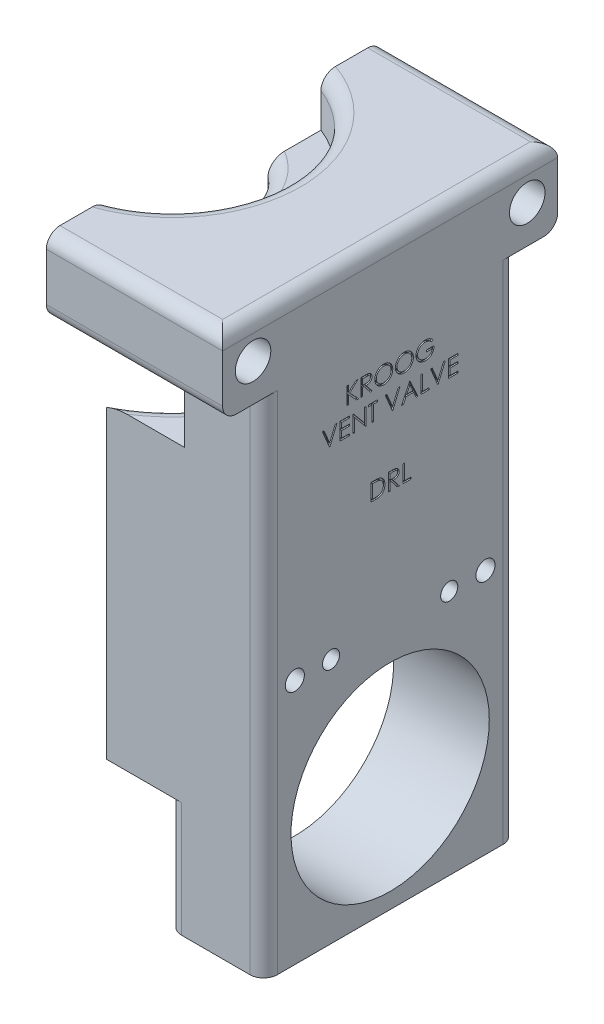
from build123d import *

# Parameters (mm, degrees)
SKETCH2_R                = 18.415
BOSS_EXTRUDE1_DEPTH      = 17.78
BOSS_EXTRUDE2_DEPTH      = 11.43
CUT_EXTRUDE1_START       = -13.97
SKETCH5_R                = 34.925
CUT_EXTRUDE1_DEPTH       = 15.24
CUT_EXTRUDE2_START       = -29.21
SKETCH5_3_R              = 25.4
CUT_EXTRUDE2_DEPTH       = 41.91
SKETCH6_W                = 62.23
SKETCH6_H                = 13.97
BOSS_EXTRUDE3_DEPTH      = 3.530092
BOSS_EXTRUDE5_DEPTH      = 11.43
SKETCH13_R               = 1.778
SKETCH13_R_2             = 1.5875
CUT_EXTRUDE5_DEPTH       = 98.68337548
CUT_EXTRUDE6_START       = -13.97
CUT_EXTRUDE6_OUTLINE_R   = 1.5875
CUT_EXTRUDE6_OUTLINE_R_2 = 1.778
CUT_EXTRUDE6_DEPTH       = 10.623863236
SKETCH15_R               = 3.302
CUT_EXTRUDE7_DEPTH       = 98.683375514
SKETCH17_R               = 21.336
CUT_EXTRUDE9_DEPTH       = 8.89
SKETCH18_R               = 12.7
SKETCH18_R_2             = 2.050850912
CUT_EXTRUDE10_DEPTH      = 8.89
CUT_EXTRUDE8_DEPTH       = 0.254
FILLET1_R                = 2.54
FILLET6_R                = 1.27
FILLET7_R                = 2.54
SKETCH19_R               = 4.064
CUT_EXTRUDE11_DEPTH      = 1.27


# Read off the part's stored shape, not the designer's step: Cut-Extrude6
with BuildPart() as part:
    # Sketch2 → Boss-Extrude1 (new body)
    with BuildSketch(Plane(origin=(0, 0, 0), x_dir=(0, 0, -1), z_dir=(1, 0, 0))):
        Polygon((-23.495, -21.336), (23.495, -21.336), (23.495, 72.644), (31.115, 72.644), (31.115, 86.614), (23.495, 86.614), (-23.495, 86.614), (-31.115, 86.614), (-31.115, 72.644), (-23.495, 72.644), align=None)
        Circle(SKETCH2_R, mode=Mode.SUBTRACT)
    extrude(amount=BOSS_EXTRUDE1_DEPTH)

    # Sketch4 → Boss-Extrude2 (add)
    with BuildSketch(Plane.ZY):
        Polygon((-23.495, 18.796), (23.495, 18.796), (23.495, 72.644), (31.115, 72.644), (31.115, 86.614), (-31.115, 86.614), (-31.115, 72.644), (-23.495, 72.644), align=None)
    extrude(amount=BOSS_EXTRUDE2_DEPTH)

    # Sketch5 → Cut-Extrude1 (cut)
    with BuildSketch(Plane(origin=(0, 86.614, 0), x_dir=(1, 0, 0), z_dir=(0, 1, 0)).offset(CUT_EXTRUDE1_START)):
        with Locations((-22.73046, 0)):
            Circle(SKETCH5_R)
    extrude(amount=-CUT_EXTRUDE1_DEPTH, mode=Mode.SUBTRACT)

    # Sketch5<3> → Cut-Extrude2 (cut)
    with BuildSketch(Plane(origin=(0, 86.614, 0), x_dir=(1, 0, 0), z_dir=(0, 1, 0)).offset(CUT_EXTRUDE2_START)):
        with Locations((-22.73046, 0)):
            Circle(SKETCH5_3_R)
    extrude(amount=-CUT_EXTRUDE2_DEPTH, mode=Mode.SUBTRACT)

    # Sketch6 → Boss-Extrude3 (add)
    with BuildSketch(Plane.ZY.offset(11.43)):
        with Locations((0, 79.629)):
            Rectangle(SKETCH6_W, SKETCH6_H)
    extrude(amount=BOSS_EXTRUDE3_DEPTH)

    # Sketch12 → Boss-Extrude5 (add)
    with BuildSketch(Plane.ZY):
        with BuildLine():
            Line((-23.495, 18.796), (-11.335174819, 18.796))
            Line((-11.335174819, 18.796), (-11.335174819, 15.310660071))
            ThreePointArc((-11.335174819, 15.310660071), (-17.012312898, 8.572263986), (-19.05, 0))
            Line((-19.05, 0), (-23.495, 0))
            Line((-23.495, 0), (-23.495, 18.796))
        make_face()
        with BuildLine():
            Line((19.05, 0), (23.495, 0))
            Line((23.495, 0), (23.495, 18.796))
            Line((23.495, 18.796), (11.335174819, 18.796))
            Line((11.335174819, 18.796), (11.335174819, 15.310660071))
            ThreePointArc((11.335174819, 15.310660071), (17.012312898, 8.572263986), (19.05, 0))
        make_face()
    extrude(amount=BOSS_EXTRUDE5_DEPTH)

    # Sketch13 → Cut-Extrude5 (cut, through all)
    with BuildSketch(Plane(origin=(17.78, 0, 0), x_dir=(0, 0, -1), z_dir=(1, 0, 0))):
        with Locations((-17.7038, 24.384)):
            Circle(SKETCH13_R)
        with Locations((-10.9728, 24.384)):
            Circle(SKETCH13_R_2)
        with Locations((17.7038, 24.384)):
            Circle(SKETCH13_R)
        with Locations((10.9728, 24.384)):
            Circle(SKETCH13_R_2)
    extrude(amount=-CUT_EXTRUDE5_DEPTH, mode=Mode.SUBTRACT)

    # Cut-Extrude6 outline → Cut-Extrude6 (cut)
    # profile 1 of 2: a face of its own
    with BuildSketch(Plane.ZY.offset(11.43).offset(CUT_EXTRUDE6_START)):
        with BuildLine():
            Line((7.9248, 21.336), (17.703787428, 21.336))
            ThreePointArc((17.703787428, 21.336), (19.859057024, 22.228734086), (20.7518, 24.384))
            Line((20.7518, 24.384), (20.7518, 49.784))
            Line((20.7518, 49.784), (7.9248, 49.784))
            Line((7.9248, 49.784), (7.9248, 21.336))
        make_face()
        with Locations((10.9728, 24.384)):
            Circle(CUT_EXTRUDE6_OUTLINE_R, mode=Mode.SUBTRACT)
        with Locations((17.7038, 24.384)):
            Circle(CUT_EXTRUDE6_OUTLINE_R_2, mode=Mode.SUBTRACT)
    # profile 2 of 2: a face of its own
    with BuildSketch(Plane.ZY.offset(11.43).offset(CUT_EXTRUDE6_START)):
        with BuildLine():
            Line((-17.703799921, 21.336), (-7.9248, 21.336))
            Line((-7.9248, 21.336), (-7.9248, 49.784))
            Line((-7.9248, 49.784), (-20.7518, 49.784))
            Line((-20.7518, 49.784), (-20.7518, 24.384))
            ThreePointArc((-20.7518, 24.384), (-19.859061441, 22.228738503), (-17.703799921, 21.336))
        make_face()
        with Locations((-17.7038, 24.384)):
            Circle(CUT_EXTRUDE6_OUTLINE_R_2, mode=Mode.SUBTRACT)
        with Locations((-10.9728, 24.384)):
            Circle(CUT_EXTRUDE6_OUTLINE_R, mode=Mode.SUBTRACT)
    extrude(amount=CUT_EXTRUDE6_DEPTH, mode=Mode.SUBTRACT)

    # Sketch15 → Cut-Extrude7 (cut, through all)
    with BuildSketch(Plane.ZY.offset(14.960092)):
        with Locations((-25.4635, 79.629)):
            Circle(SKETCH15_R)
        with Locations(Location((25.4635, 79.629, 0), (0, 0, 180))):
            Circle(SKETCH15_R)
    extrude(amount=-CUT_EXTRUDE7_DEPTH, mode=Mode.SUBTRACT)

    # Sketch17 → Cut-Extrude9 (cut)
    with BuildSketch(Plane(origin=(0, 86.614, 0), x_dir=(1, 0, 0), z_dir=(0, 1, 0))):
        with Locations((-22.707092, 0)):
            Circle(SKETCH17_R)
    extrude(amount=-CUT_EXTRUDE9_DEPTH, mode=Mode.SUBTRACT)

    # Sketch18 → Cut-Extrude10 (cut)
    with BuildSketch(Plane(origin=(0, 77.724, 0), x_dir=(1, 0, 0), z_dir=(0, 1, 0))):
        with Locations((-22.707092, 0)):
            Circle(SKETCH18_R)
        with Locations(Location((-5.22986, 0, 0), (0, 0, 270))):
            Circle(SKETCH18_R_2)
    extrude(amount=-CUT_EXTRUDE10_DEPTH, mode=Mode.SUBTRACT)

    # Sketch16 → Cut-Extrude8 (cut)
    # profile 1 of 17: a face of its own
    with BuildSketch(Plane(origin=(17.78, 0, 0), x_dir=(0, 0, -1), z_dir=(1, 0, 0))):
        Polygon((-7.978205128, 66.929), (-7.693269231, 66.929), (-7.693269231, 65.719930489), (-6.369716546, 66.929), (-5.963301282, 66.929), (-7.523452524, 65.504320513), (-5.841185897, 63.754), (-6.221524439, 63.754), (-7.693269231, 65.286166466), (-7.693269231, 63.754), (-7.978205128, 63.754), align=None)
    # profile 2 of 17: a face of its own
    with BuildSketch(Plane(origin=(17.78, 0, 0), x_dir=(0, 0, -1), z_dir=(1, 0, 0))):
        with BuildLine():
            Line((-5.373076923, 66.929), (-4.737695313, 66.929))
            add(Edge.make_bspline(
                [(-4.737695313, 66.929), (-4.695294432, 66.928858861), (-4.613880043, 66.928587859), (-4.49724572, 66.927076774), (-4.391266853, 66.922745752), (-4.295998856, 66.91901868), (-4.211443476, 66.912222418), (-4.137341434, 66.905726689), (-4.074034023, 66.897223439), (-4.035711, 66.889326377), (-4.018359375, 66.885750801)],
                knots=[0, 0, 0, 0, 1.410062039, 2.707475311, 3.878576406, 4.937260626, 5.877586885, 6.699081471, 7.410979367, 8, 8, 8, 8], degree=3))
            add(Edge.make_bspline(
                [(-4.018359375, 66.885750801), (-3.995130509, 66.880011521), (-3.949168311, 66.868655396), (-3.88299218, 66.844652758), (-3.819932757, 66.816876384), (-3.760251988, 66.784252152), (-3.704248806, 66.746537888), (-3.651345767, 66.704384662), (-3.601302811, 66.658023126), (-3.556143761, 66.606284377), (-3.513563335, 66.552004114), (-3.477650796, 66.493308563), (-3.446693203, 66.431929892), (-3.422045663, 66.367243877), (-3.402199216, 66.299877841), (-3.388205413, 66.229221576), (-3.379813264, 66.155596977), (-3.378958866, 66.105379445), (-3.378525641, 66.079916466)],
                knots=[0, 0, 0, 0, 1.027469482, 2.033020251, 3.019912614, 3.986113645, 4.951240523, 5.91722682, 6.890402269, 7.87763091, 8.8651537, 9.85103654, 10.82876324, 11.815024772, 12.821070561, 13.842952187, 14.906261191, 16, 16, 16, 16], degree=3))
            add(Edge.make_bspline(
                [(-3.378525641, 66.079916466), (-3.379858232, 66.037611764), (-3.382458463, 65.955064333), (-3.40670195, 65.835266248), (-3.446413507, 65.723515941), (-3.501135347, 65.61995412), (-3.570821586, 65.526599463), (-3.654573361, 65.444602407), (-3.752437394, 65.375986201), (-3.843541131, 65.328404013), (-3.924017583, 65.297930446), (-3.990269231, 65.276488892), (-4.062538561, 65.259922681), (-4.140133143, 65.245081704), (-4.223375888, 65.233876953), (-4.312067281, 65.225670399), (-4.406270575, 65.220541369), (-4.470985303, 65.219777551), (-4.504276843, 65.219384615)],
                knots=[0, 0, 0, 0, 1.260483769, 2.459530307, 3.627416485, 4.787058657, 5.939039949, 7.08810263, 8.267026773, 9.491475466, 10.141966685, 10.831826277, 11.566392101, 12.351337768, 13.187381173, 14.07005841, 15.007169909, 16, 16, 16, 16], degree=3))
            Line((-4.504276843, 65.219384615), (-3.337820513, 63.754))
            Line((-3.337820513, 63.754), (-3.690174279, 63.754))
            Line((-3.690174279, 63.754), (-4.856630609, 65.219384615))
            Line((-4.856630609, 65.219384615), (-5.088141026, 65.219384615))
            Line((-5.088141026, 65.219384615), (-5.088141026, 63.754))
            Line((-5.088141026, 63.754), (-5.373076923, 63.754))
            Line((-5.373076923, 63.754), (-5.373076923, 66.929))
        make_face()
        with BuildLine():
            Line((-5.088141026, 66.603358974), (-5.088141026, 65.545025641))
            Line((-5.088141026, 65.545025641), (-4.506820913, 65.540573518))
            add(Edge.make_bspline(
                [(-4.506820913, 65.540573518), (-4.479679164, 65.54056151), (-4.427070723, 65.540538236), (-4.350960834, 65.544161162), (-4.280094733, 65.5482826), (-4.214743479, 65.55458665), (-4.154877878, 65.562711086), (-4.100527854, 65.572873793), (-4.051604685, 65.584713879), (-3.994546725, 65.603039639), (-3.930832157, 65.63207367), (-3.861588619, 65.674315229), (-3.802622212, 65.727445788), (-3.752803866, 65.78820028), (-3.712772167, 65.854998877), (-3.68454909, 65.927040869), (-3.666639874, 66.002507533), (-3.664527551, 66.054376245), (-3.663461538, 66.080552484)],
                knots=[0, 0, 0, 0, 1.146690395, 2.22261258, 3.21895312, 4.145990853, 4.996080663, 5.770904154, 6.481378293, 7.121626537, 8.300444488, 9.431385265, 10.535395872, 11.636531494, 12.74115979, 13.810798291, 14.895190096, 16, 16, 16, 16], degree=3))
            add(Edge.make_bspline(
                [(-3.663461538, 66.080552484), (-3.664552034, 66.106085447), (-3.666712998, 66.156682464), (-3.68435581, 66.23075604), (-3.714191177, 66.300666773), (-3.754397779, 66.36613027), (-3.803382726, 66.42555333), (-3.860821028, 66.476396105), (-3.925142169, 66.518350976), (-3.985259613, 66.545161022), (-4.038993506, 66.561598317), (-4.085647555, 66.573165444), (-4.138362967, 66.582458641), (-4.197395704, 66.589904525), (-4.262493755, 66.596304367), (-4.333986274, 66.600614909), (-4.411398925, 66.603167486), (-4.465053641, 66.603293659), (-4.492828526, 66.603358974)],
                knots=[0, 0, 0, 0, 1.101028733, 2.181837193, 3.264309656, 4.369019818, 5.486613113, 6.575447106, 7.666700264, 8.788928104, 9.402425223, 10.0903467, 10.862060571, 11.710948788, 12.657782767, 13.684531032, 14.801375019, 16, 16, 16, 16], degree=3))
            Line((-4.492828526, 66.603358974), (-5.088141026, 66.603358974))
        make_face(mode=Mode.SUBTRACT)
    # profile 3 of 17: a face of its own
    with BuildSketch(Plane(origin=(17.78, 0, 0), x_dir=(0, 0, -1), z_dir=(1, 0, 0))):
        with BuildLine():
            add(Edge.make_bspline(
                [(-1.200801282, 67.010410256), (-1.142011072, 67.0089212), (-1.026542248, 67.005996571), (-0.856838591, 66.983609098), (-0.694827326, 66.94487828), (-0.5391887, 66.893295432), (-0.391784357, 66.824484668), (-0.25150479, 66.74131314), (-0.118683769, 66.642909496), (0.004888484, 66.530034411), (0.117970146, 66.407222278), (0.217597915, 66.276160174), (0.301093424, 66.137640546), (0.369660531, 65.99207965), (0.423452841, 65.839806679), (0.460572259, 65.680009834), (0.484283296, 65.513724479), (0.487055322, 65.400307252), (0.488461538, 65.342772035)],
                knots=[0, 0, 0, 0, 1.065120563, 2.091984664, 3.0946048, 4.079830382, 5.057816894, 6.036188127, 7.030412546, 8.04752943, 9.064399622, 10.05169764, 11.02544977, 11.989514704, 12.962713494, 13.945757189, 14.957906945, 16, 16, 16, 16], degree=3))
            add(Edge.make_bspline(
                [(0.488461538, 65.342772035), (0.487055528, 65.285660637), (0.484284119, 65.173087456), (0.4605453, 65.007857332), (0.42331525, 64.849025057), (0.370160065, 64.696855786), (0.30191981, 64.551188996), (0.217868333, 64.412407974), (0.118861663, 64.280467222), (0.006188306, 64.156812161), (-0.116639782, 64.043421599), (-0.248384382, 63.944616618), (-0.386082608, 63.859595448), (-0.531506414, 63.791755973), (-0.682727162, 63.737534302), (-0.841098269, 63.700565845), (-1.005877643, 63.676719741), (-1.11824634, 63.673981516), (-1.175360577, 63.672589744)],
                knots=[0, 0, 0, 0, 1.043624062, 2.057103931, 3.04512605, 4.022047818, 4.998200453, 5.980619268, 6.982898556, 8.009068085, 9.034988726, 10.034168286, 11.015286542, 11.987931943, 12.962482838, 13.94673481, 14.956375938, 16, 16, 16, 16], degree=3))
            add(Edge.make_bspline(
                [(-1.175360577, 63.672589744), (-1.232895495, 63.673995259), (-1.346312134, 63.676765903), (-1.512806444, 63.700516178), (-1.67271554, 63.737655789), (-1.82558213, 63.790732206), (-1.971491459, 63.859327837), (-2.110728892, 63.942970381), (-2.242735547, 64.042218287), (-2.366416988, 64.154855109), (-2.479582332, 64.277475017), (-2.578242623, 64.408860377), (-2.661903976, 64.546433541), (-2.730269285, 64.690576295), (-2.784393473, 64.840591818), (-2.821318558, 64.997480794), (-2.845209028, 65.160348774), (-2.847962068, 65.271240546), (-2.849358974, 65.327507612)],
                knots=[0, 0, 0, 0, 1.053102029, 2.075944431, 3.073151272, 4.055350789, 5.033113405, 6.020478099, 7.024410459, 8.052272461, 9.079885166, 10.07527673, 11.055994387, 12.023226415, 12.992069828, 13.970394897, 14.97016774, 16, 16, 16, 16], degree=3))
            add(Edge.make_bspline(
                [(-2.849358974, 65.327507612), (-2.848873984, 65.365274391), (-2.84791012, 65.440331503), (-2.836306228, 65.551789061), (-2.819468113, 65.661454158), (-2.795336378, 65.769014947), (-2.763775366, 65.874208126), (-2.726535313, 65.977759175), (-2.68105131, 66.078618696), (-2.629633865, 66.177264487), (-2.572246368, 66.272158801), (-2.508859081, 66.361856709), (-2.441698425, 66.447110899), (-2.368071632, 66.525712109), (-2.290405286, 66.599946926), (-2.207439471, 66.668674534), (-2.119680435, 66.732514668), (-2.026750562, 66.790045977), (-1.930939699, 66.842078906), (-1.832172907, 66.886730157), (-1.731791589, 66.92505337), (-1.629325587, 66.95611469), (-1.525047001, 66.980636608), (-1.418728239, 66.997334708), (-1.310454002, 67.008968196), (-1.237509449, 67.009927501), (-1.200801282, 67.010410256)],
                knots=[0, 0, 0, 0, 1.037015668, 2.060948919, 3.074880161, 4.083647147, 5.086022904, 6.090072063, 7.104153813, 8.122640571, 9.144368836, 10.147691507, 11.138137339, 12.123020368, 13.103399296, 14.087645067, 15.080126199, 16.082011238, 17.087798457, 18.072939717, 19.057185487, 20.037253025, 21.01195951, 21.997135196, 22.992090687, 24, 24, 24, 24], degree=3))
        make_face()
        with BuildLine():
            add(Edge.make_bspline(
                [(-1.186808894, 66.684769231), (-1.216939312, 66.684401937), (-1.276912098, 66.683670862), (-1.366070213, 66.674040892), (-1.454055753, 66.660315921), (-1.540886889, 66.640738399), (-1.626200308, 66.614064722), (-1.710791236, 66.583366184), (-1.793888292, 66.545972766), (-1.875217149, 66.50372467), (-1.954061538, 66.456962435), (-2.028458774, 66.405280903), (-2.098601459, 66.349892072), (-2.164317851, 66.290666676), (-2.225414985, 66.227303109), (-2.283095393, 66.160761971), (-2.335047085, 66.089141327), (-2.382659001, 66.014383315), (-2.425265542, 65.936585309), (-2.463152685, 65.856566362), (-2.494144322, 65.773673747), (-2.519419477, 65.688806761), (-2.540374306, 65.602099815), (-2.553649365, 65.512895152), (-2.563385149, 65.421641015), (-2.564074437, 65.359971762), (-2.564423077, 65.328779647)],
                knots=[0, 0, 0, 0, 1.008559885, 2.007477868, 2.99961109, 3.989939068, 4.984837346, 5.991145699, 7.001802488, 8.033829008, 9.059044045, 10.069351652, 11.065060232, 12.050310815, 13.029377138, 14.011219647, 14.996725999, 15.989392538, 16.977580475, 17.965360261, 18.951710183, 19.937753436, 20.929683414, 21.935841486, 22.955955122, 24, 24, 24, 24], degree=3))
            add(Edge.make_bspline(
                [(-2.564423077, 65.328779647), (-2.563266595, 65.28291249), (-2.560991437, 65.192677602), (-2.541072784, 65.060445071), (-2.510391422, 64.933364983), (-2.465163668, 64.81213268), (-2.408602753, 64.69570608), (-2.33872836, 64.585118014), (-2.255943332, 64.480338592), (-2.161905705, 64.382099312), (-2.059105821, 64.292432047), (-1.949946844, 64.213725241), (-1.835598215, 64.147131657), (-1.715761738, 64.092879913), (-1.591077185, 64.04989065), (-1.460741121, 64.020427892), (-1.325621775, 64.001037301), (-1.233518966, 63.999175158), (-1.186808894, 63.998230769)],
                knots=[0, 0, 0, 0, 1.032063989, 2.030389145, 3.003944642, 3.970395727, 4.937377036, 5.913328081, 6.909231446, 7.93887556, 8.970685674, 9.976071282, 10.964166581, 11.944589148, 12.933237628, 13.927779006, 14.949070134, 16, 16, 16, 16], degree=3))
            add(Edge.make_bspline(
                [(-1.186808894, 63.998230769), (-1.155413132, 63.99866212), (-1.093145906, 63.999517617), (-1.000530682, 64.008134274), (-0.909583976, 64.021951755), (-0.820433351, 64.041845993), (-0.733179986, 64.06674453), (-0.6474597, 64.096324398), (-0.564185537, 64.133228061), (-0.48230697, 64.174002274), (-0.403933236, 64.220484417), (-0.329116146, 64.270411882), (-0.259741507, 64.32571913), (-0.194074278, 64.384064575), (-0.132726303, 64.446624637), (-0.076112439, 64.513317981), (-0.024423319, 64.584565577), (0.023170517, 64.659210195), (0.065627763, 64.737221081), (0.102620231, 64.817530146), (0.134003851, 64.899939638), (0.159338994, 64.984568421), (0.179192235, 65.071255762), (0.192871876, 65.160117733), (0.202440817, 65.250976565), (0.203162066, 65.312429921), (0.203525641, 65.343408053)],
                knots=[0, 0, 0, 0, 1.047197238, 2.076906641, 3.100256066, 4.114471768, 5.12198147, 6.126382909, 7.136867548, 8.15857795, 9.17633901, 10.174870724, 11.156907918, 12.133735059, 13.104061851, 14.077631395, 15.04955518, 16.038496417, 17.029181396, 18.010275684, 18.986308667, 19.968651475, 20.955262928, 21.950658345, 22.966943676, 24, 24, 24, 24], degree=3))
            add(Edge.make_bspline(
                [(0.203525641, 65.343408053), (0.203161774, 65.37417426), (0.202439977, 65.4352047), (0.192876447, 65.525429871), (0.179177782, 65.613652427), (0.159435897, 65.69952602), (0.1339904, 65.783072539), (0.102614751, 65.864213517), (0.065616658, 65.943251237), (0.023154911, 66.019990349), (-0.024575157, 66.093627433), (-0.076730649, 66.164023907), (-0.134212072, 66.229857751), (-0.195377109, 66.292754224), (-0.261753555, 66.351371881), (-0.333040736, 66.405730167), (-0.408373215, 66.457140923), (-0.488135779, 66.503519112), (-0.570453508, 66.546349166), (-0.65492117, 66.583044004), (-0.740581854, 66.614224427), (-0.827217727, 66.640819102), (-0.915558, 66.660239244), (-1.005005759, 66.67405326), (-1.095437251, 66.68366751), (-1.156255029, 66.684400825), (-1.186808894, 66.684769231)],
                knots=[0, 0, 0, 0, 1.02996197, 2.043119294, 3.035359645, 4.018872909, 4.991431989, 5.957985074, 6.929999688, 7.912076566, 8.892894881, 9.867085534, 10.843653904, 11.817741046, 12.803660682, 13.806313499, 14.818574707, 15.856120519, 16.894564902, 17.924820532, 18.937903209, 19.946497019, 20.957711757, 21.963978472, 22.977135795, 24, 24, 24, 24], degree=3))
        make_face(mode=Mode.SUBTRACT)
    # profile 4 of 17: a face of its own
    with BuildSketch(Plane(origin=(17.78, 0, 0), x_dir=(0, 0, -1), z_dir=(1, 0, 0))):
        with BuildLine():
            add(Edge.make_bspline(
                [(2.625480769, 67.010410256), (2.68427098, 67.0089212), (2.799739803, 67.005996571), (2.96944346, 66.983609098), (3.131454725, 66.94487828), (3.287093351, 66.893295432), (3.434497694, 66.824484668), (3.574777261, 66.74131314), (3.707598282, 66.642909496), (3.831170536, 66.530034411), (3.944252198, 66.407222278), (4.043879966, 66.276160174), (4.127375475, 66.137640546), (4.195942582, 65.99207965), (4.249734892, 65.839806679), (4.286854311, 65.680009834), (4.310565347, 65.513724479), (4.313337373, 65.400307252), (4.31474359, 65.342772035)],
                knots=[0, 0, 0, 0, 1.065120563, 2.091984664, 3.0946048, 4.079830382, 5.057816894, 6.036188127, 7.030412546, 8.04752943, 9.064399622, 10.05169764, 11.02544977, 11.989514704, 12.962713494, 13.945757189, 14.957906945, 16, 16, 16, 16], degree=3))
            add(Edge.make_bspline(
                [(4.31474359, 65.342772035), (4.31333758, 65.285660637), (4.31056617, 65.173087456), (4.286827351, 65.007857332), (4.249597301, 64.849025057), (4.196442117, 64.696855786), (4.128201861, 64.551188996), (4.044150384, 64.412407974), (3.945143715, 64.280467222), (3.832470357, 64.156812161), (3.709642269, 64.043421599), (3.57789767, 63.944616618), (3.440199444, 63.859595448), (3.294775637, 63.791755973), (3.143554889, 63.737534302), (2.985183782, 63.700565845), (2.820404408, 63.676719741), (2.708035712, 63.673981516), (2.650921474, 63.672589744)],
                knots=[0, 0, 0, 0, 1.043624062, 2.057103931, 3.04512605, 4.022047818, 4.998200453, 5.980619268, 6.982898556, 8.009068085, 9.034988726, 10.034168286, 11.015286542, 11.987931943, 12.962482838, 13.94673481, 14.956375938, 16, 16, 16, 16], degree=3))
            add(Edge.make_bspline(
                [(2.650921474, 63.672589744), (2.593386556, 63.673995259), (2.479969918, 63.676765903), (2.313475607, 63.700516178), (2.153566511, 63.737655789), (2.000699921, 63.790732206), (1.854790592, 63.859327837), (1.71555316, 63.942970381), (1.583546505, 64.042218287), (1.459865063, 64.154855109), (1.346699719, 64.277475017), (1.248039428, 64.408860377), (1.164378076, 64.546433541), (1.096012767, 64.690576295), (1.041888579, 64.840591818), (1.004963494, 64.997480794), (0.981073023, 65.160348774), (0.978319983, 65.271240546), (0.976923077, 65.327507612)],
                knots=[0, 0, 0, 0, 1.053102029, 2.075944431, 3.073151272, 4.055350789, 5.033113405, 6.020478099, 7.024410459, 8.052272461, 9.079885166, 10.07527673, 11.055994387, 12.023226415, 12.992069828, 13.970394897, 14.97016774, 16, 16, 16, 16], degree=3))
            add(Edge.make_bspline(
                [(0.976923077, 65.327507612), (0.977408068, 65.365274391), (0.978371931, 65.440331503), (0.989975823, 65.551789061), (1.006813938, 65.661454158), (1.030945673, 65.769014947), (1.062506685, 65.874208126), (1.099746739, 65.977759175), (1.145230741, 66.078618696), (1.196648186, 66.177264487), (1.254035683, 66.272158801), (1.31742297, 66.361856709), (1.384583626, 66.447110899), (1.458210419, 66.525712109), (1.535876766, 66.599946926), (1.61884258, 66.668674534), (1.706601616, 66.732514668), (1.799531489, 66.790045977), (1.895342353, 66.842078906), (1.994109144, 66.886730157), (2.094490462, 66.92505337), (2.196956465, 66.95611469), (2.301235051, 66.980636608), (2.407553812, 66.997334708), (2.515828049, 67.008968196), (2.588772603, 67.009927501), (2.625480769, 67.010410256)],
                knots=[0, 0, 0, 0, 1.037015668, 2.060948919, 3.074880161, 4.083647147, 5.086022904, 6.090072063, 7.104153813, 8.122640571, 9.144368836, 10.147691507, 11.138137339, 12.123020368, 13.103399296, 14.087645067, 15.080126199, 16.082011238, 17.087798457, 18.072939717, 19.057185487, 20.037253025, 21.01195951, 21.997135196, 22.992090687, 24, 24, 24, 24], degree=3))
        make_face()
        with BuildLine():
            add(Edge.make_bspline(
                [(2.639473157, 66.684769231), (2.609342739, 66.684401937), (2.549369953, 66.683670862), (2.460211838, 66.674040892), (2.372226298, 66.660315921), (2.285395162, 66.640738399), (2.200081743, 66.614064722), (2.115490815, 66.583366184), (2.032393759, 66.545972766), (1.951064903, 66.50372467), (1.872220513, 66.456962435), (1.797823277, 66.405280903), (1.727680593, 66.349892072), (1.661964201, 66.290666676), (1.600867066, 66.227303109), (1.543186658, 66.160761971), (1.491234966, 66.089141327), (1.44362305, 66.014383315), (1.401016509, 65.936585309), (1.363129366, 65.856566362), (1.33213773, 65.773673747), (1.306862574, 65.688806761), (1.285907746, 65.602099815), (1.272632686, 65.512895152), (1.262896903, 65.421641015), (1.262207614, 65.359971762), (1.261858974, 65.328779647)],
                knots=[0, 0, 0, 0, 1.008559885, 2.007477868, 2.99961109, 3.989939068, 4.984837346, 5.991145699, 7.001802488, 8.033829008, 9.059044045, 10.069351652, 11.065060232, 12.050310815, 13.029377138, 14.011219647, 14.996725999, 15.989392538, 16.977580475, 17.965360261, 18.951710183, 19.937753436, 20.929683414, 21.935841486, 22.955955122, 24, 24, 24, 24], degree=3))
            add(Edge.make_bspline(
                [(1.261858974, 65.328779647), (1.263015456, 65.28291249), (1.265290614, 65.192677602), (1.285209267, 65.060445071), (1.315890629, 64.933364983), (1.361118383, 64.81213268), (1.417679298, 64.69570608), (1.487553691, 64.585118014), (1.570338719, 64.480338592), (1.664376347, 64.382099312), (1.76717623, 64.292432047), (1.876335207, 64.213725241), (1.990683837, 64.147131657), (2.110520313, 64.092879913), (2.235204867, 64.04989065), (2.365540931, 64.020427892), (2.500660276, 64.001037301), (2.592763085, 63.999175158), (2.639473157, 63.998230769)],
                knots=[0, 0, 0, 0, 1.032063989, 2.030389145, 3.003944642, 3.970395727, 4.937377036, 5.913328081, 6.909231446, 7.93887556, 8.970685674, 9.976071282, 10.964166581, 11.944589148, 12.933237628, 13.927779006, 14.949070134, 16, 16, 16, 16], degree=3))
            add(Edge.make_bspline(
                [(2.639473157, 63.998230769), (2.670868919, 63.99866212), (2.733136145, 63.999517617), (2.825751369, 64.008134274), (2.916698075, 64.021951755), (3.005848701, 64.041845993), (3.093102065, 64.06674453), (3.178822351, 64.096324398), (3.262096514, 64.133228061), (3.343975081, 64.174002274), (3.422348815, 64.220484417), (3.497165905, 64.270411882), (3.566540544, 64.32571913), (3.632207773, 64.384064575), (3.693555748, 64.446624637), (3.750169612, 64.513317981), (3.801858732, 64.584565577), (3.849452569, 64.659210195), (3.891909814, 64.737221081), (3.928902283, 64.817530146), (3.960285902, 64.899939638), (3.985621046, 64.984568421), (4.005474286, 65.071255762), (4.019153927, 65.160117733), (4.028722868, 65.250976565), (4.029444117, 65.312429921), (4.029807692, 65.343408053)],
                knots=[0, 0, 0, 0, 1.047197238, 2.076906641, 3.100256066, 4.114471768, 5.12198147, 6.126382909, 7.136867548, 8.15857795, 9.17633901, 10.174870724, 11.156907918, 12.133735059, 13.104061851, 14.077631395, 15.04955518, 16.038496417, 17.029181396, 18.010275684, 18.986308667, 19.968651475, 20.955262928, 21.950658345, 22.966943676, 24, 24, 24, 24], degree=3))
            add(Edge.make_bspline(
                [(4.029807692, 65.343408053), (4.029443826, 65.37417426), (4.028722029, 65.4352047), (4.019158498, 65.525429871), (4.005459833, 65.613652427), (3.985717948, 65.69952602), (3.960272452, 65.783072539), (3.928896802, 65.864213517), (3.891898709, 65.943251237), (3.849436962, 66.019990349), (3.801706894, 66.093627433), (3.749551402, 66.164023907), (3.692069979, 66.229857751), (3.630904942, 66.292754224), (3.564528496, 66.351371881), (3.493241315, 66.405730167), (3.417908836, 66.457140923), (3.338146272, 66.503519112), (3.255828543, 66.546349166), (3.171360881, 66.583044004), (3.085700198, 66.614224427), (2.999064324, 66.640819102), (2.910724051, 66.660239244), (2.821276292, 66.67405326), (2.7308448, 66.68366751), (2.670027023, 66.684400825), (2.639473157, 66.684769231)],
                knots=[0, 0, 0, 0, 1.02996197, 2.043119294, 3.035359645, 4.018872909, 4.991431989, 5.957985074, 6.929999688, 7.912076566, 8.892894881, 9.867085534, 10.843653904, 11.817741046, 12.803660682, 13.806313499, 14.818574707, 15.856120519, 16.894564902, 17.924820532, 18.937903209, 19.946497019, 20.957711757, 21.963978472, 22.977135795, 24, 24, 24, 24], degree=3))
        make_face(mode=Mode.SUBTRACT)
    # profile 5 of 17: a face of its own
    with BuildSketch(Plane(origin=(17.78, 0, 0), x_dir=(0, 0, -1), z_dir=(1, 0, 0))):
        with BuildLine():
            Line((7.9375, 66.387112981), (7.693269231, 66.155602564))
            add(Edge.make_bspline(
                [(7.693269231, 66.155602564), (7.649074239, 66.197177704), (7.561738111, 66.279336601), (7.419352749, 66.385935861), (7.270795738, 66.477254395), (7.116842258, 66.551555052), (6.961304856, 66.610839342), (6.806248037, 66.653047012), (6.653262294, 66.679964242), (6.551510603, 66.68318312), (6.501372196, 66.684769231)],
                knots=[0, 0, 0, 0, 1.08915593, 2.152340314, 3.188132944, 4.216796309, 5.218260357, 6.173443236, 7.099959455, 8, 8, 8, 8], degree=3))
            add(Edge.make_bspline(
                [(6.501372196, 66.684769231), (6.470606718, 66.684394031), (6.409155554, 66.683644605), (6.317877076, 66.674079495), (6.227555912, 66.660322797), (6.138362565, 66.64041838), (6.050123613, 66.61519159), (5.963145946, 66.583636205), (5.877267317, 66.546846805), (5.793296658, 66.504335847), (5.711889201, 66.457636272), (5.635002643, 66.405885096), (5.562146917, 66.350740979), (5.494691388, 66.290823305), (5.43224804, 66.22667482), (5.373330589, 66.159488821), (5.320011185, 66.08742973), (5.271849913, 66.011823341), (5.22888616, 65.933997569), (5.190959738, 65.8547015), (5.159121665, 65.774198146), (5.133930802, 65.69238649), (5.113147566, 65.609899455), (5.098526594, 65.526165887), (5.090283639, 65.441096129), (5.08885781, 65.384130045), (5.088141026, 65.355492388)],
                knots=[0, 0, 0, 0, 1.02818874, 2.053710826, 3.065248034, 4.081641283, 5.106893873, 6.131558223, 7.173050175, 8.228653731, 9.27666206, 10.308777013, 11.325269123, 12.329503258, 13.32196095, 14.316845687, 15.314881793, 16.315733098, 17.311955233, 18.285320748, 19.252783886, 20.203351036, 21.145449891, 22.095197417, 23.042428769, 24, 24, 24, 24], degree=3))
            add(Edge.make_bspline(
                [(5.088141026, 65.355492388), (5.08882657, 65.326218146), (5.090195787, 65.267749602), (5.098959077, 65.180487836), (5.115222552, 65.094522078), (5.136964688, 65.009569843), (5.164161571, 64.92548564), (5.198063918, 64.842634006), (5.238219141, 64.761018008), (5.284698013, 64.681373027), (5.335666927, 64.603791427), (5.392765293, 64.530712433), (5.453417394, 64.461162899), (5.51983286, 64.396687027), (5.589882016, 64.335560207), (5.665657724, 64.279466555), (5.745669956, 64.227325596), (5.830040783, 64.179794467), (5.917854736, 64.137332438), (6.007894791, 64.099573618), (6.100448595, 64.068477362), (6.195029749, 64.043133511), (6.291525503, 64.02235967), (6.390425666, 64.008995206), (6.491003052, 63.999297095), (6.558801668, 63.998588008), (6.592958734, 63.998230769)],
                knots=[0, 0, 0, 0, 0.93586088, 1.869166235, 2.799637598, 3.729985548, 4.670839027, 5.622275134, 6.589130586, 7.576015415, 8.568469353, 9.55398029, 10.53834874, 11.515998671, 12.510579167, 13.508179873, 14.527009472, 15.561807829, 16.601455013, 17.643573243, 18.680854198, 19.719860599, 20.772568776, 21.833555941, 22.908541556, 24, 24, 24, 24], degree=3))
            add(Edge.make_bspline(
                [(6.592958734, 63.998230769), (6.634123378, 63.999091263), (6.714956843, 64.000780984), (6.833780259, 64.013934818), (6.947901616, 64.034478695), (7.057000243, 64.064564901), (7.161202855, 64.102940378), (7.260891452, 64.149200478), (7.355281171, 64.205119539), (7.444655764, 64.268232975), (7.526985496, 64.338550002), (7.60123888, 64.414427472), (7.666231574, 64.495497075), (7.722932265, 64.581281326), (7.769839402, 64.672490281), (7.80834108, 64.768676963), (7.837853423, 64.869884634), (7.849968293, 64.939817757), (7.856089744, 64.975153846)],
                knots=[0, 0, 0, 0, 1.13008108, 2.219097802, 3.278683437, 4.311054135, 5.322181354, 6.324827112, 7.324222904, 8.330512327, 9.32562643, 10.293043162, 11.24128371, 12.174520618, 13.111833804, 14.052305215, 15.015860969, 16, 16, 16, 16], degree=3))
            Line((7.856089744, 64.975153846), (6.79775641, 64.975153846))
            Line((6.79775641, 64.975153846), (6.79775641, 65.300794872))
            Line((6.79775641, 65.300794872), (8.141025641, 65.300794872))
            add(Edge.make_bspline(
                [(8.141025641, 65.300794872), (8.139478193, 65.240100221), (8.136449557, 65.121309826), (8.115205255, 64.948072509), (8.080900276, 64.784449616), (8.034036993, 64.630268829), (7.97337156, 64.485748642), (7.899555053, 64.35074232), (7.811406057, 64.226122045), (7.712064442, 64.110870449), (7.600576623, 64.008064664), (7.479955089, 63.917707849), (7.350000554, 63.841596191), (7.210835943, 63.779674018), (7.062916835, 63.731346894), (6.905900948, 63.697082678), (6.74000121, 63.676554069), (6.626302939, 63.673931175), (6.568154046, 63.672589744)],
                knots=[0, 0, 0, 0, 1.140356446, 2.231883559, 3.274166699, 4.278491846, 5.25512956, 6.21435461, 7.1637429, 8.11826594, 9.068280886, 10.0076534, 10.945064095, 11.891975133, 12.864533718, 13.863980011, 14.907571808, 16, 16, 16, 16], degree=3))
            add(Edge.make_bspline(
                [(6.568154046, 63.672589744), (6.532312709, 63.673106018), (6.461622041, 63.674124277), (6.357218128, 63.681360871), (6.255692858, 63.692501108), (6.157061021, 63.709324184), (6.060959811, 63.72992962), (5.967869187, 63.75631543), (5.877434536, 63.78685775), (5.789516077, 63.821597396), (5.70491181, 63.861848828), (5.623244898, 63.906579715), (5.544063912, 63.955559407), (5.467908213, 64.00963496), (5.394380999, 64.068401906), (5.323956375, 64.131978032), (5.256240086, 64.200168976), (5.213821665, 64.248591364), (5.192447917, 64.272990385)],
                knots=[0, 0, 0, 0, 1.107784379, 2.184907829, 3.233506516, 4.263428166, 5.276301166, 6.270063455, 7.25232949, 8.225834625, 9.190232166, 10.146266622, 11.1027726, 12.066435141, 13.031522626, 14.010570082, 14.99756817, 16, 16, 16, 16], degree=3))
            add(Edge.make_bspline(
                [(5.192447917, 64.272990385), (5.161436393, 64.311698763), (5.099928104, 64.388473), (5.020754348, 64.511481521), (4.953261647, 64.638846065), (4.898499408, 64.770921192), (4.85573843, 64.907583364), (4.825071329, 65.04865795), (4.807103288, 65.194326615), (4.804514722, 65.292901533), (4.803205128, 65.342772035)],
                knots=[0, 0, 0, 0, 1.023165419, 2.029347347, 3.013907458, 3.994755782, 4.975994455, 5.96558838, 6.970761222, 8, 8, 8, 8], degree=3))
            add(Edge.make_bspline(
                [(4.803205128, 65.342772035), (4.803687944, 65.380115707), (4.80464744, 65.454328436), (4.816282015, 65.564507565), (4.83297473, 65.672730336), (4.857510273, 65.778908283), (4.888440456, 65.88311232), (4.927042547, 65.98539083), (4.971986845, 66.085804171), (5.024225117, 66.18366118), (5.082358876, 66.277663326), (5.145450862, 66.36743219), (5.214396985, 66.451332985), (5.288071317, 66.530428266), (5.367352873, 66.603724363), (5.451498921, 66.671899877), (5.540574311, 66.73504626), (5.634859274, 66.792168896), (5.732946531, 66.84348018), (5.834600961, 66.888464679), (5.939791533, 66.925642401), (6.047730173, 66.957187187), (6.159233906, 66.980514493), (6.273493571, 66.997431569), (6.391104744, 67.009007256), (6.470603143, 67.009938217), (6.51091246, 67.010410256)],
                knots=[0, 0, 0, 0, 1.008945113, 2.00506715, 2.99143336, 3.967273523, 4.948097931, 5.927297278, 6.919902385, 7.919676788, 8.923139349, 9.905703106, 10.883022732, 11.856032218, 12.825136022, 13.798837087, 14.781400844, 15.773989409, 16.776158564, 17.77167057, 18.775803737, 19.789618931, 20.80898985, 21.851988756, 22.910860228, 24, 24, 24, 24], degree=3))
            add(Edge.make_bspline(
                [(6.51091246, 67.010410256), (6.543785724, 67.009884575), (6.608969543, 67.008842209), (6.705966457, 67.001617136), (6.801464121, 66.990165472), (6.895604132, 66.974538316), (6.988065907, 66.953253397), (7.079112847, 66.927782381), (7.168876933, 66.898126228), (7.257076845, 66.862757774), (7.34430563, 66.822613415), (7.4310483, 66.777425524), (7.517008473, 66.726421413), (7.60233522, 66.669449634), (7.687566606, 66.607488677), (7.771354531, 66.538766415), (7.855721488, 66.465992915), (7.909970276, 66.413666934), (7.9375, 66.387112981)],
                knots=[0, 0, 0, 0, 0.985871117, 1.954866573, 2.915460327, 3.869826059, 4.81536089, 5.759505086, 6.70452669, 7.649098992, 8.607881297, 9.583363685, 10.581137262, 11.603961102, 12.659522466, 13.73993555, 14.853081303, 16, 16, 16, 16], degree=3))
        make_face()
    # profile 6 of 17: a face of its own
    with BuildSketch(Plane(origin=(17.78, 0, 0), x_dir=(0, 0, -1), z_dir=(1, 0, 0))):
        Polygon((-12.598237179, 61.849), (-12.292948718, 61.849), (-11.235251402, 59.348814704), (-10.176918069, 61.849), (-9.87099359, 61.849), (-11.214262821, 58.674), (-11.254967949, 58.674), align=None)
    # profile 7 of 17: a face of its own
    with BuildSketch(Plane(origin=(17.78, 0, 0), x_dir=(0, 0, -1), z_dir=(1, 0, 0))):
        Polygon((-9.301121795, 61.849), (-7.510096154, 61.849), (-7.510096154, 61.523358974), (-9.016185897, 61.523358974), (-9.016185897, 60.546435897), (-7.510096154, 60.546435897), (-7.510096154, 60.220794872), (-9.016185897, 60.220794872), (-9.016185897, 58.999641026), (-7.510096154, 58.999641026), (-7.510096154, 58.674), (-9.301121795, 58.674), align=None)
    # profile 8 of 17: a face of its own
    with BuildSketch(Plane(origin=(17.78, 0, 0), x_dir=(0, 0, -1), z_dir=(1, 0, 0))):
        Polygon((-6.940224359, 58.674), (-6.940224359, 61.849), (-6.880438702, 61.849), (-4.782852564, 59.350086739), (-4.782852564, 61.849), (-4.497916667, 61.849), (-4.497916667, 58.674), (-4.562790465, 58.674), (-6.655288462, 61.167189103), (-6.655288462, 58.674), align=None)
    # profile 9 of 17: a face of its own
    with BuildSketch(Plane(origin=(17.78, 0, 0), x_dir=(0, 0, -1), z_dir=(1, 0, 0))):
        Polygon((-4.050160256, 61.523358974), (-4.050160256, 61.849), (-2.38125, 61.849), (-2.38125, 61.523358974), (-3.073237179, 61.523358974), (-3.073237179, 58.674), (-3.358173077, 58.674), (-3.358173077, 61.523358974), align=None)
    # profile 10 of 17: a face of its own
    with BuildSketch(Plane(origin=(17.78, 0, 0), x_dir=(0, 0, -1), z_dir=(1, 0, 0))):
        Polygon((-0.915865385, 61.849), (-0.610576923, 61.849), (0.447120393, 59.348814704), (1.505453726, 61.849), (1.811378205, 61.849), (0.468108974, 58.674), (0.427403846, 58.674), align=None)
    # profile 11 of 17: a face of its own
    with BuildSketch(Plane(origin=(17.78, 0, 0), x_dir=(0, 0, -1), z_dir=(1, 0, 0))):
        Polygon((3.683814103, 61.849), (5.149198718, 58.674), (4.839458133, 58.674), (4.370077123, 59.691628205), (2.930769231, 59.691628205), (2.448667869, 58.674), (2.137019231, 58.674), (3.643108974, 61.849), align=None)
        Polygon((3.66028145, 61.22951883), (3.085957532, 60.017269231), (4.219976963, 60.017269231), align=None, mode=Mode.SUBTRACT)
    # profile 12 of 17: a face of its own
    with BuildSketch(Plane(origin=(17.78, 0, 0), x_dir=(0, 0, -1), z_dir=(1, 0, 0))):
        Polygon((5.719070513, 61.849), (6.00400641, 61.849), (6.00400641, 58.999641026), (7.225160256, 58.999641026), (7.225160256, 58.674), (5.719070513, 58.674), align=None)
    # profile 13 of 17: a face of its own
    with BuildSketch(Plane(origin=(17.78, 0, 0), x_dir=(0, 0, -1), z_dir=(1, 0, 0))):
        Polygon((7.510096154, 61.849), (7.815384615, 61.849), (8.873081931, 59.348814704), (9.931415264, 61.849), (10.237339744, 61.849), (8.894070513, 58.674), (8.853365385, 58.674), align=None)
    # profile 14 of 17: a face of its own
    with BuildSketch(Plane(origin=(17.78, 0, 0), x_dir=(0, 0, -1), z_dir=(1, 0, 0))):
        Polygon((10.807211538, 61.849), (12.598237179, 61.849), (12.598237179, 61.523358974), (11.092147436, 61.523358974), (11.092147436, 60.546435897), (12.598237179, 60.546435897), (12.598237179, 60.220794872), (11.092147436, 60.220794872), (11.092147436, 58.999641026), (12.598237179, 58.999641026), (12.598237179, 58.674), (10.807211538, 58.674), align=None)
    # profile 15 of 17: a face of its own
    with BuildSketch(Plane(origin=(17.78, 0, 0), x_dir=(0, 0, -1), z_dir=(1, 0, 0))):
        with BuildLine():
            Line((-3.582051282, 45.974), (-3.582051282, 49.149))
            Line((-3.582051282, 49.149), (-2.940945513, 49.149))
            add(Edge.make_bspline(
                [(-2.940945513, 49.149), (-2.885184359, 49.148598526), (-2.777454101, 49.14782288), (-2.621777095, 49.142904903), (-2.477737539, 49.134204981), (-2.34580916, 49.121532625), (-2.225629774, 49.105972373), (-2.117535894, 49.086468435), (-2.020968593, 49.063437737), (-1.961578458, 49.043802222), (-1.93349359, 49.034516827)],
                knots=[0, 0, 0, 0, 1.314313732, 2.53924729, 3.670748893, 4.714932338, 5.66265055, 6.526160246, 7.303039223, 8, 8, 8, 8], degree=3))
            add(Edge.make_bspline(
                [(-1.93349359, 49.034516827), (-1.896759076, 49.020518973), (-1.824123066, 48.992840689), (-1.720702319, 48.940628901), (-1.623342883, 48.881471302), (-1.531522659, 48.815289912), (-1.447339052, 48.740210824), (-1.367503317, 48.659423325), (-1.295281389, 48.569989617), (-1.229143149, 48.473764449), (-1.169511515, 48.371881373), (-1.117678136, 48.264534524), (-1.074630585, 48.152269057), (-1.038895301, 48.035397173), (-1.010731729, 47.913661887), (-0.99151669, 47.786921452), (-0.978843007, 47.655676758), (-0.977569332, 47.566618495), (-0.976923077, 47.521430889)],
                knots=[0, 0, 0, 0, 0.984719456, 1.947108742, 2.898477687, 3.838006223, 4.779231079, 5.722358779, 6.681677486, 7.655904652, 8.64651281, 9.637519902, 10.640069247, 11.656948941, 12.698408672, 13.768548281, 14.867775369, 16, 16, 16, 16], degree=3))
            add(Edge.make_bspline(
                [(-0.976923077, 47.521430889), (-0.97749364, 47.482186766), (-0.978617995, 47.404852122), (-0.988713874, 47.290877881), (-1.003388108, 47.180284855), (-1.026106773, 47.073599684), (-1.053686196, 46.969887658), (-1.089032247, 46.870254122), (-1.129523019, 46.773785095), (-1.176739694, 46.681784956), (-1.228575093, 46.594623612), (-1.284202675, 46.512458668), (-1.343563106, 46.436462574), (-1.40722243, 46.36640519), (-1.474358001, 46.30239213), (-1.545409358, 46.243888659), (-1.62055984, 46.192039498), (-1.699472853, 46.144807193), (-1.784450484, 46.103604442), (-1.877102306, 46.068742933), (-1.977823446, 46.039853503), (-2.086366678, 46.015749905), (-2.202919547, 45.996629781), (-2.327596323, 45.983815125), (-2.46020545, 45.97514925), (-2.551263784, 45.974390522), (-2.598132011, 45.974)],
                knots=[0, 0, 0, 0, 1.105936401, 2.179363191, 3.223086493, 4.248585256, 5.251745608, 6.245858792, 7.225916811, 8.198733463, 9.158002045, 10.082870192, 10.993790845, 11.873723703, 12.748670949, 13.606408763, 14.465103618, 15.319838547, 16.196477973, 17.123216899, 18.106603292, 19.147568657, 20.255746949, 21.433717677, 22.679120308, 24, 24, 24, 24], degree=3))
            Line((-2.598132011, 45.974), (-3.582051282, 45.974))
        make_face()
        with BuildLine():
            Line((-3.297115385, 46.299641026), (-2.932677284, 46.299641026))
            add(Edge.make_bspline(
                [(-2.932677284, 46.299641026), (-2.880309404, 46.299866084), (-2.779586794, 46.300298955), (-2.634754183, 46.304097347), (-2.50242073, 46.310303961), (-2.382567647, 46.318989925), (-2.275262603, 46.330482168), (-2.180281344, 46.343295473), (-2.097935217, 46.359258875), (-2.048106371, 46.373728674), (-2.025080128, 46.380415264)],
                knots=[0, 0, 0, 0, 1.375205317, 2.645023457, 3.804390687, 4.853969522, 5.800190428, 6.637939096, 7.370582563, 8, 8, 8, 8], degree=3))
            add(Edge.make_bspline(
                [(-2.025080128, 46.380415264), (-1.9960984, 46.390622035), (-1.938827171, 46.410791788), (-1.856385044, 46.447583381), (-1.779498332, 46.491164401), (-1.706827095, 46.539607892), (-1.6394022, 46.59462248), (-1.576424609, 46.655011877), (-1.518021118, 46.721083423), (-1.464795139, 46.792755112), (-1.417162606, 46.869580856), (-1.375913705, 46.950805369), (-1.339762672, 47.03553869), (-1.311388521, 47.125081998), (-1.289149383, 47.218634787), (-1.273397131, 47.316203637), (-1.263586631, 47.417770329), (-1.262442317, 47.486851184), (-1.261858974, 47.522066907)],
                knots=[0, 0, 0, 0, 0.998632004, 1.973411704, 2.929992603, 3.868527914, 4.809262121, 5.754881198, 6.702106254, 7.672490631, 8.653608572, 9.636854334, 10.631411391, 11.644891563, 12.686317036, 13.754757253, 14.855430412, 16, 16, 16, 16], degree=3))
            add(Edge.make_bspline(
                [(-1.261858974, 47.522066907), (-1.262324599, 47.559199421), (-1.263239324, 47.632146574), (-1.274736734, 47.739180991), (-1.291538431, 47.842124152), (-1.31583506, 47.940982944), (-1.346796643, 48.035950235), (-1.385436068, 48.12650079), (-1.429583644, 48.213590921), (-1.482110243, 48.295210525), (-1.539637245, 48.372402131), (-1.603480036, 48.443118376), (-1.672624313, 48.507520348), (-1.746315927, 48.56661101), (-1.826631724, 48.618013059), (-1.911679715, 48.66399312), (-2.002707574, 48.703014678), (-2.066037662, 48.723769075), (-2.098222155, 48.734316506)],
                knots=[0, 0, 0, 0, 1.122418816, 2.205001699, 3.251619955, 4.274784885, 5.280384055, 6.268708349, 7.249350384, 8.229342522, 9.199999885, 10.157847722, 11.105861043, 12.055065948, 13.010012805, 13.98527497, 14.976112212, 16, 16, 16, 16], degree=3))
            add(Edge.make_bspline(
                [(-2.098222155, 48.734316506), (-2.124847838, 48.741679266), (-2.181461345, 48.757334513), (-2.273844287, 48.774411815), (-2.377816602, 48.789474468), (-2.493839902, 48.802227118), (-2.621781933, 48.811377759), (-2.761741092, 48.818246023), (-2.913777877, 48.822878468), (-3.019172032, 48.823194796), (-3.073873197, 48.823358974)],
                knots=[0, 0, 0, 0, 0.674548936, 1.434276114, 2.292660221, 3.240891867, 4.284742987, 5.42552168, 6.663806718, 8, 8, 8, 8], degree=3))
            Line((-3.073873197, 48.823358974), (-3.297115385, 48.823358974))
            Line((-3.297115385, 48.823358974), (-3.297115385, 46.299641026))
        make_face(mode=Mode.SUBTRACT)
    # profile 16 of 17: a face of its own
    with BuildSketch(Plane(origin=(17.78, 0, 0), x_dir=(0, 0, -1), z_dir=(1, 0, 0))):
        with BuildLine():
            Line((-0.325641026, 49.149), (0.309740585, 49.149))
            add(Edge.make_bspline(
                [(0.309740585, 49.149), (0.352141466, 49.148858861), (0.433555854, 49.148587859), (0.550190178, 49.147076774), (0.656169044, 49.142745752), (0.751437041, 49.13901868), (0.835992421, 49.132222418), (0.910094464, 49.125726689), (0.973401875, 49.117223439), (1.011724897, 49.109326377), (1.029076522, 49.105750801)],
                knots=[0, 0, 0, 0, 1.410062039, 2.707475311, 3.878576406, 4.937260626, 5.877586885, 6.699081471, 7.410979367, 8, 8, 8, 8], degree=3))
            add(Edge.make_bspline(
                [(1.029076522, 49.105750801), (1.052305389, 49.100011521), (1.098267586, 49.088655396), (1.164443718, 49.064652758), (1.22750314, 49.036876384), (1.287183909, 49.004252152), (1.343187091, 48.966537888), (1.39609013, 48.924384662), (1.446133086, 48.878023126), (1.491292137, 48.826284377), (1.533872562, 48.772004114), (1.569785102, 48.713308563), (1.600742694, 48.651929892), (1.625390235, 48.587243877), (1.645236682, 48.519877841), (1.659230485, 48.449221576), (1.667622634, 48.375596977), (1.668477031, 48.325379445), (1.668910256, 48.299916466)],
                knots=[0, 0, 0, 0, 1.027469482, 2.033020251, 3.019912614, 3.986113645, 4.951240523, 5.91722682, 6.890402269, 7.87763091, 8.8651537, 9.85103654, 10.82876324, 11.815024772, 12.821070561, 13.842952187, 14.906261191, 16, 16, 16, 16], degree=3))
            add(Edge.make_bspline(
                [(1.668910256, 48.299916466), (1.667577665, 48.257611764), (1.664977435, 48.175064333), (1.640733948, 48.055266248), (1.601022391, 47.943515941), (1.54630055, 47.83995412), (1.476614311, 47.746599463), (1.392862536, 47.664602407), (1.294998503, 47.595986201), (1.203894767, 47.548404013), (1.123418314, 47.517930446), (1.057166666, 47.496488892), (0.984897336, 47.479922681), (0.907302754, 47.465081704), (0.82406001, 47.453876953), (0.735368617, 47.445670399), (0.641165322, 47.440541369), (0.576450595, 47.439777551), (0.543159054, 47.439384615)],
                knots=[0, 0, 0, 0, 1.260483769, 2.459530307, 3.627416485, 4.787058657, 5.939039949, 7.08810263, 8.267026773, 9.491475466, 10.141966685, 10.831826277, 11.566392101, 12.351337768, 13.187381173, 14.07005841, 15.007169909, 16, 16, 16, 16], degree=3))
            Line((0.543159054, 47.439384615), (1.709615385, 45.974))
            Line((1.709615385, 45.974), (1.357261619, 45.974))
            Line((1.357261619, 45.974), (0.190805288, 47.439384615))
            Line((0.190805288, 47.439384615), (-0.040705128, 47.439384615))
            Line((-0.040705128, 47.439384615), (-0.040705128, 45.974))
            Line((-0.040705128, 45.974), (-0.325641026, 45.974))
            Line((-0.325641026, 45.974), (-0.325641026, 49.149))
        make_face()
        with BuildLine():
            Line((-0.040705128, 48.823358974), (-0.040705128, 47.765025641))
            Line((-0.040705128, 47.765025641), (0.540614984, 47.760573518))
            add(Edge.make_bspline(
                [(0.540614984, 47.760573518), (0.567756734, 47.76056151), (0.620365175, 47.760538236), (0.696475063, 47.764161162), (0.767341165, 47.7682826), (0.832692419, 47.77458665), (0.892558019, 47.782711086), (0.946908044, 47.792873793), (0.995831212, 47.804713879), (1.052889172, 47.823039639), (1.11660374, 47.85207367), (1.185847279, 47.894315229), (1.244813685, 47.947445788), (1.294632031, 48.00820028), (1.33466373, 48.074998877), (1.362886808, 48.147040869), (1.380796023, 48.222507533), (1.382908347, 48.274376245), (1.383974359, 48.300552484)],
                knots=[0, 0, 0, 0, 1.146690395, 2.22261258, 3.21895312, 4.145990853, 4.996080663, 5.770904154, 6.481378293, 7.121626537, 8.300444488, 9.431385265, 10.535395872, 11.636531494, 12.74115979, 13.810798291, 14.895190096, 16, 16, 16, 16], degree=3))
            add(Edge.make_bspline(
                [(1.383974359, 48.300552484), (1.382883863, 48.326085447), (1.380722899, 48.376682464), (1.363080088, 48.45075604), (1.33324472, 48.520666773), (1.293038119, 48.58613027), (1.244053171, 48.64555333), (1.18661487, 48.696396105), (1.122293728, 48.738350976), (1.062176284, 48.765161022), (1.008442391, 48.781598317), (0.961788342, 48.793165444), (0.909072931, 48.802458641), (0.850040193, 48.809904525), (0.784942142, 48.816304367), (0.713449623, 48.820614909), (0.636036972, 48.823167486), (0.582382256, 48.823293659), (0.554607372, 48.823358974)],
                knots=[0, 0, 0, 0, 1.101028733, 2.181837193, 3.264309656, 4.369019818, 5.486613113, 6.575447106, 7.666700264, 8.788928104, 9.402425223, 10.0903467, 10.862060571, 11.710948788, 12.657782767, 13.684531032, 14.801375019, 16, 16, 16, 16], degree=3))
            Line((0.554607372, 48.823358974), (-0.040705128, 48.823358974))
        make_face(mode=Mode.SUBTRACT)
    # profile 17 of 17: a face of its own
    with BuildSketch(Plane(origin=(17.78, 0, 0), x_dir=(0, 0, -1), z_dir=(1, 0, 0))):
        Polygon((2.360897436, 49.149), (2.645833333, 49.149), (2.645833333, 46.299641026), (3.866987179, 46.299641026), (3.866987179, 45.974), (2.360897436, 45.974), align=None)
    extrude(amount=-CUT_EXTRUDE8_DEPTH, mode=Mode.SUBTRACT)

    # Fillet1
    fillet1_edges = [part.edges().sort_by_distance(p)[0] for p in [
        (-1.371092, 86.614, 0),
        (-10.007092, 77.724, 0),
    ]]
    fillet(fillet1_edges, radius=FILLET1_R)

    # Fillet6
    fillet6_edges = [part.edges().sort_by_distance(p)[0] for p in [
        (2.54, 24.384, -15.9258),
        (2.54, 24.384, -9.3853),
        (2.54, 24.384, 12.5603),
        (2.54, 24.384, 19.4818),
    ]]
    fillet(fillet6_edges, radius=FILLET6_R - 0.0001)  # a hair under: the kernel refuses the full size

    # Fillet7
    fillet7_edges = [part.edges().sort_by_distance(p)[0] for p in [
        (2.66954, 57.404, 0),
        (0, -10.668, -23.495),
        (0, -10.668, 23.495),
        (17.78, 25.654, -23.495),
        (17.78, 25.654, 23.495),
        (17.78, 86.614, 0),
        (1.409954, 72.644, 31.115),
        (1.409954, 86.614, 31.115),
        (1.409954, 72.644, -31.115),
        (1.409954, 86.614, -31.115),
    ]]
    fillet(fillet7_edges, radius=FILLET7_R)

    # Sketch19 → Cut-Extrude11 (cut)
    with BuildSketch(Plane.XZ.offset(-72.644)):
        with Locations(Location((-5.22986, 0, 0), (0, 0, 270))):
            Circle(SKETCH19_R)
    extrude(amount=-CUT_EXTRUDE11_DEPTH, mode=Mode.SUBTRACT)


solid = part.part
